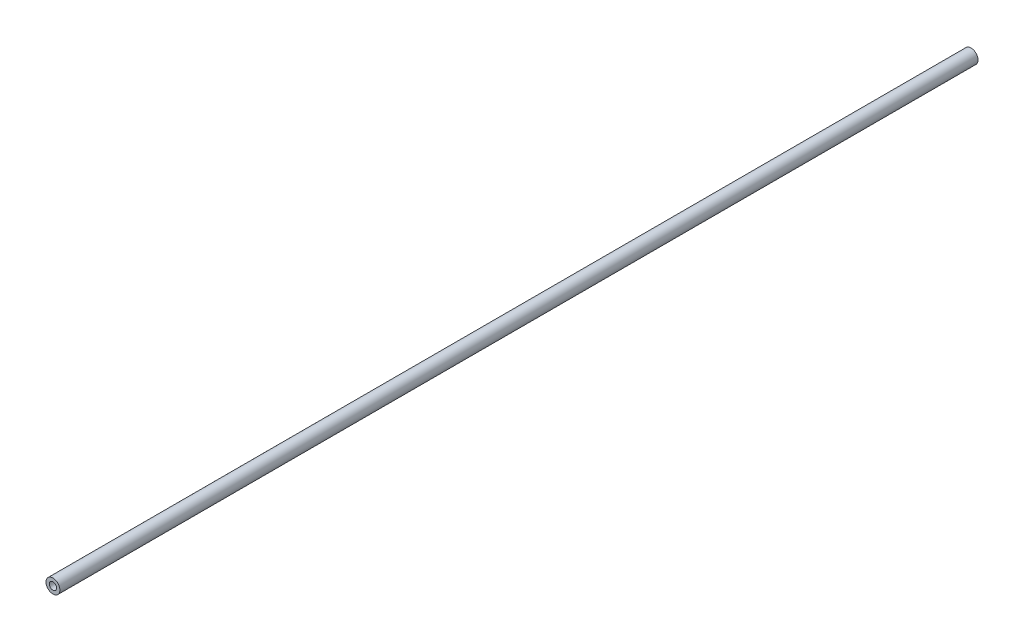
from build123d import *

# Parameters (mm, degrees)
SKETCH1_R           = 4.7625
SKETCH1_R_2         = 2.4892
BOSS_EXTRUDE1_DEPTH = 628.65


with BuildPart() as part:
    # Sketch1 → Boss-Extrude1 (new body)
    with BuildSketch(Plane.XY):
        Circle(SKETCH1_R)
        Circle(SKETCH1_R_2, mode=Mode.SUBTRACT)
    extrude(amount=BOSS_EXTRUDE1_DEPTH)


solid = part.part
